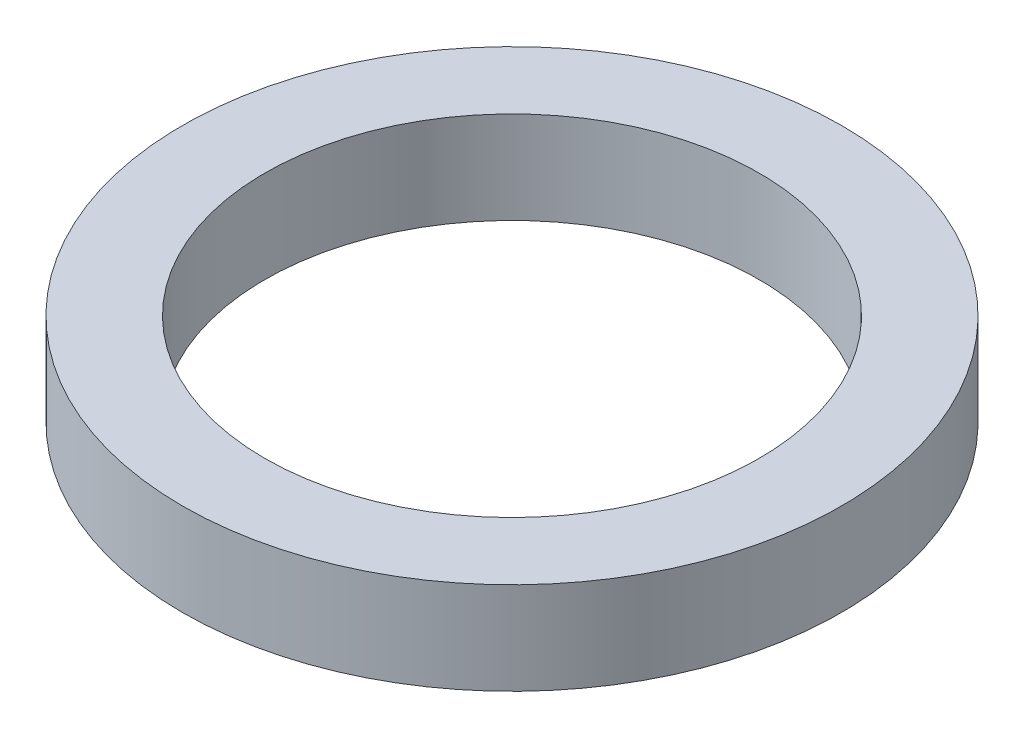
from build123d import *

# Parameters (mm, degrees)
SKETCH1_R           = 50
BOSS_EXTRUDE1_DEPTH = 14
SKETCH2_R           = 37.5
CUT_EXTRUDE1_DEPTH  = 73.083285164


with BuildPart() as part:
    # Sketch1 → Boss-Extrude1 (new body)
    with BuildSketch(Plane(origin=(0, 0, 0), x_dir=(1, 0, 0), z_dir=(0, 1, 0))):
        Circle(SKETCH1_R)
    extrude(amount=BOSS_EXTRUDE1_DEPTH)

    # Sketch2 → Cut-Extrude1 (cut, through all)
    with BuildSketch(Plane(origin=(0, 0, 0), x_dir=(1, 0, 0), z_dir=(0, 1, 0))):
        Circle(SKETCH2_R)
    extrude(amount=CUT_EXTRUDE1_DEPTH, mode=Mode.SUBTRACT)


solid = part.part
